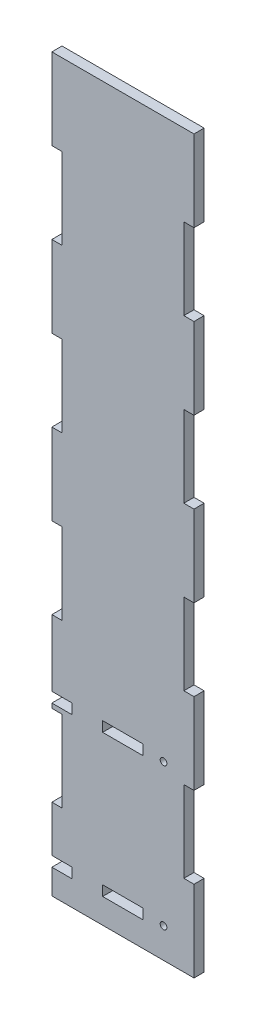
from build123d import *

# Parameters (mm, degrees)
SKETCH2_W           = 6.35
SKETCH2_H           = 88.9
BOSS_EXTRUDE1_DEPTH = 457.2
SKETCH4_W           = 6.35
SKETCH4_H           = 50.8
CUT_EXTRUDE1_DEPTH  = 460.399570091
SKETCH5_W           = 25.4
SKETCH5_H           = 6.35
CUT_EXTRUDE2_DEPTH  = 460.399570091
SKETCH6_R           = 2.0955
CUT_EXTRUDE3_DEPTH  = 460.399570091
SKETCH7_W           = 12.7
SKETCH7_H           = 6.35
CUT_EXTRUDE4_DEPTH  = 10
SKETCH8_W           = 12.7
SKETCH8_H           = 6.35
CUT_EXTRUDE5_DEPTH  = 460.399570091


with BuildPart() as part:
    # Sketch2 → Boss-Extrude1 (new body)
    with BuildSketch(Plane.ZX):
        with Locations((41.275, 0)):
            Rectangle(SKETCH2_W, SKETCH2_H)
    extrude(amount=BOSS_EXTRUDE1_DEPTH)

    # Sketch4 → Cut-Extrude1 (cut, through all)
    with BuildSketch(Plane.XY.offset(44.45)):
        with Locations((41.275, 381)):
            Rectangle(SKETCH4_W, SKETCH4_H)
        with Locations((41.275, 279.4)):
            Rectangle(SKETCH4_W, SKETCH4_H)
        with Locations((41.275, 177.8)):
            Rectangle(SKETCH4_W, SKETCH4_H)
        with Locations((41.275, 76.2)):
            Rectangle(SKETCH4_W, SKETCH4_H)
    cut_extrude1 = extrude(amount=-CUT_EXTRUDE1_DEPTH, mode=Mode.SUBTRACT)

    # Mirror1: Cut-Extrude1 across plane
    add(cut_extrude1.mirror(Plane(origin=(0, 0, 0), x_dir=(0, 0, 1), z_dir=(1, 0, 0))), mode=Mode.SUBTRACT)

    # Sketch5 → Cut-Extrude2 (cut, through all)
    with BuildSketch(Plane(origin=(0, 0, 38.1), x_dir=(-1, 0, 0), z_dir=(0, 0, -1))):
        with Locations((0, 107.6625)):
            Rectangle(SKETCH5_W, SKETCH5_H)
        with Locations((0, 18.7625)):
            Rectangle(SKETCH5_W, SKETCH5_H)
    extrude(amount=-CUT_EXTRUDE2_DEPTH, mode=Mode.SUBTRACT)

    # Sketch6 → Cut-Extrude3 (cut, through all)
    with BuildSketch(Plane.XY.offset(44.45)):
        with Locations((25.4, 107.6625)):
            Circle(SKETCH6_R)
        with Locations((25.4, 18.7625)):
            Circle(SKETCH6_R)
    extrude(amount=-CUT_EXTRUDE3_DEPTH, mode=Mode.SUBTRACT)

    # Sketch7 → Cut-Extrude4 (cut)
    with BuildSketch(Plane(origin=(0, 0, 38.1), x_dir=(-1, 0, 0), z_dir=(0, 0, -1))):
        with Locations((38.1, 107.6625)):
            Rectangle(SKETCH7_W, SKETCH7_H)
    extrude(amount=-CUT_EXTRUDE4_DEPTH, mode=Mode.SUBTRACT)

    # Sketch8 → Cut-Extrude5 (cut, through all)
    with BuildSketch(Plane(origin=(0, 0, 38.1), x_dir=(-1, 0, 0), z_dir=(0, 0, -1))):
        with Locations((38.1, 18.7625)):
            Rectangle(SKETCH8_W, SKETCH8_H)
    extrude(amount=-CUT_EXTRUDE5_DEPTH, mode=Mode.SUBTRACT)


solid = part.part
